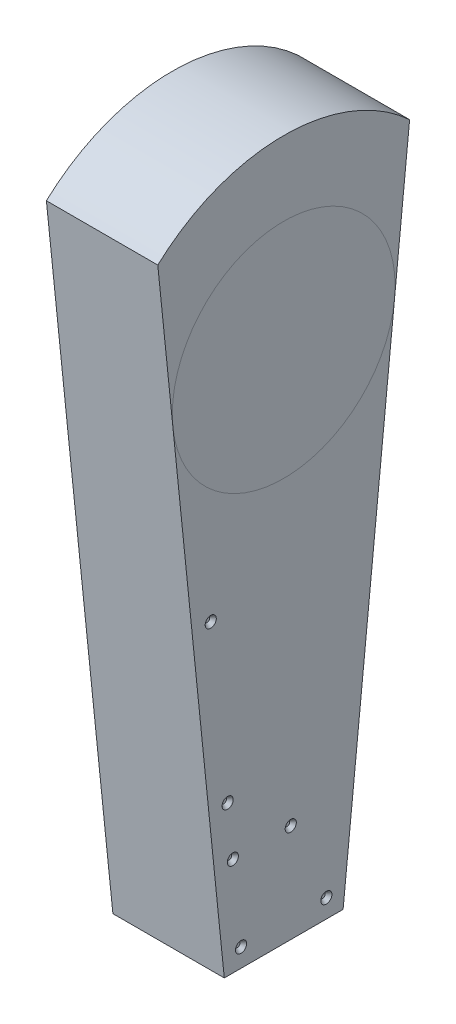
from build123d import *

# Parameters (mm, degrees)
SALIENTE_EXTRUIR1_DEPTH         = 76.2
CROQUIS4_R                      = 3.81
CORTAR_EXTRUIR1_DEPTH           = 2.54
CORTAR_EXTRUIR1_DRAFT           = -39
CORTAR_EXTRUIR1_PROFILE_2_DEPTH = 2.54
CORTAR_EXTRUIR1_PROFILE_2_DRAFT = -39
CORTAR_EXTRUIR1_PROFILE_3_DEPTH = 2.54
CORTAR_EXTRUIR1_PROFILE_3_DRAFT = -39
CORTAR_EXTRUIR1_PROFILE_4_DEPTH = 2.54
CORTAR_EXTRUIR1_PROFILE_4_DRAFT = -39
CORTAR_EXTRUIR1_PROFILE_5_DEPTH = 2.54
CORTAR_EXTRUIR1_PROFILE_5_DRAFT = -39
CORTAR_EXTRUIR1_PROFILE_6_DEPTH = 2.54
CORTAR_EXTRUIR1_PROFILE_6_DRAFT = -39
CROQUIS5_R                      = 3.81
CORTAR_EXTRUIR2_DEPTH           = 2.54
CORTAR_EXTRUIR2_DRAFT           = -39
CORTAR_EXTRUIR2_PROFILE_2_DEPTH = 2.54
CORTAR_EXTRUIR2_PROFILE_2_DRAFT = -39
CORTAR_EXTRUIR2_PROFILE_3_DEPTH = 2.54
CORTAR_EXTRUIR2_PROFILE_3_DRAFT = -39
CORTAR_EXTRUIR2_PROFILE_4_DEPTH = 2.54
CORTAR_EXTRUIR2_PROFILE_4_DRAFT = -39
CORTAR_EXTRUIR2_PROFILE_5_DEPTH = 2.54
CORTAR_EXTRUIR2_PROFILE_5_DRAFT = -39
CORTAR_EXTRUIR2_PROFILE_6_DEPTH = 2.54
CORTAR_EXTRUIR2_PROFILE_6_DRAFT = -39
CORTAR_EXTRUIR2_PROFILE_7_DEPTH = 2.54
CORTAR_EXTRUIR2_PROFILE_7_DRAFT = -39
CORTAR_EXTRUIR2_PROFILE_8_DEPTH = 2.54
CORTAR_EXTRUIR2_PROFILE_8_DRAFT = -39
CORTAR_EXTRUIR2_PROFILE_9_DEPTH = 2.54
CORTAR_EXTRUIR2_PROFILE_9_DRAFT = -39


with BuildPart() as part:
    # Croquis1 → Saliente-Extruir1 (new body)
    with BuildSketch(Plane(origin=(0, 0, 0), x_dir=(0, 0, -1), z_dir=(1, 0, 0))):
        with BuildLine():
            Line((-40.64, -351.79000001), (-86.135923686, 93.325251946))
            ThreePointArc((-86.135923686, 93.325251946), (0, 127), (86.135923686, 93.325251946))
            Line((86.135923686, 93.325251946), (40.64, -351.79000001))
            Line((40.64, -351.79000001), (-40.64, -351.79000001))
        make_face()
    extrude(amount=SALIENTE_EXTRUIR1_DEPTH)


with BuildPart() as cortar_extruir1_tool:
    # Croquis4 → Cortar-Extruir1 (with draft: the straight prism first)
    with BuildSketch(Plane(origin=(76.2, 0, 0), x_dir=(0, 0, -1), z_dir=(1, 0, 0))):
        with Locations((-49.917099877, -136.126844727)):
            Circle(CROQUIS4_R)
    extrude(amount=-CORTAR_EXTRUIR1_DEPTH)
    # Cortar-Extruir1: the draft: its side faces are tilted about the plane it starts from
    cortar_extruir1_sides = [cortar_extruir1_tool.faces().sort_by_distance(p)[0] for p in [
        (74.93, -136.126844727, 53.727099877),
    ]]
    draft(cortar_extruir1_sides, Plane(origin=(76.2, 0, 0), x_dir=(0, 0, -1), z_dir=(1, 0, 0)), CORTAR_EXTRUIR1_DRAFT)


with BuildPart() as part_1:
    add(part.part)

    # Cortar-Extruir1: cut by cortar_extruir1_tool
    add(cortar_extruir1_tool.part, mode=Mode.SUBTRACT)


with BuildPart() as cortar_extruir1_profile_2_tool:
    # Croquis4 → Cortar-Extruir1 profile 2 (with draft: the straight prism first)
    with BuildSketch(Plane(origin=(76.2, 0, 0), x_dir=(0, 0, -1), z_dir=(1, 0, 0))):
        with Locations((-38.362373799, -249.174001321)):
            Circle(CROQUIS4_R)
    extrude(amount=-CORTAR_EXTRUIR1_PROFILE_2_DEPTH)
    # Cortar-Extruir1 profile 2: the draft: its side faces are tilted about the plane it starts from
    cortar_extruir1_profile_2_sides = [cortar_extruir1_profile_2_tool.faces().sort_by_distance(p)[0] for p in [
        (74.93, -249.174001321, 42.172373799),
    ]]
    draft(cortar_extruir1_profile_2_sides, Plane(origin=(76.2, 0, 0), x_dir=(0, 0, -1), z_dir=(1, 0, 0)), CORTAR_EXTRUIR1_PROFILE_2_DRAFT)


with BuildPart() as part_2:
    add(part_1.part)

    # Cortar-Extruir1 profile 2: cut by cortar_extruir1_profile_2_tool
    add(cortar_extruir1_profile_2_tool.part, mode=Mode.SUBTRACT)


with BuildPart() as cortar_extruir1_profile_3_tool:
    # Croquis4 → Cortar-Extruir1 profile 3 (with draft: the straight prism first)
    with BuildSketch(Plane(origin=(76.2, 0, 0), x_dir=(0, 0, -1), z_dir=(1, 0, 0))):
        with Locations((-34.768096531, -284.339077712)):
            Circle(CROQUIS4_R)
    extrude(amount=-CORTAR_EXTRUIR1_PROFILE_3_DEPTH)
    # Cortar-Extruir1 profile 3: the draft: its side faces are tilted about the plane it starts from
    cortar_extruir1_profile_3_sides = [cortar_extruir1_profile_3_tool.faces().sort_by_distance(p)[0] for p in [
        (74.93, -284.339077712, 38.578096531),
    ]]
    draft(cortar_extruir1_profile_3_sides, Plane(origin=(76.2, 0, 0), x_dir=(0, 0, -1), z_dir=(1, 0, 0)), CORTAR_EXTRUIR1_PROFILE_3_DRAFT)


with BuildPart() as part_3:
    add(part_2.part)

    # Cortar-Extruir1 profile 3: cut by cortar_extruir1_profile_3_tool
    add(cortar_extruir1_profile_3_tool.part, mode=Mode.SUBTRACT)


with BuildPart() as cortar_extruir1_profile_4_tool:
    # Croquis4 → Cortar-Extruir1 profile 4 (with draft: the straight prism first)
    with BuildSketch(Plane(origin=(76.2, 0, 0), x_dir=(0, 0, -1), z_dir=(1, 0, 0))):
        with Locations((-29.171919425, -339.09000001)):
            Circle(CROQUIS4_R)
    extrude(amount=-CORTAR_EXTRUIR1_PROFILE_4_DEPTH)
    # Cortar-Extruir1 profile 4: the draft: its side faces are tilted about the plane it starts from
    cortar_extruir1_profile_4_sides = [cortar_extruir1_profile_4_tool.faces().sort_by_distance(p)[0] for p in [
        (74.93, -339.09000001, 32.981919425),
    ]]
    draft(cortar_extruir1_profile_4_sides, Plane(origin=(76.2, 0, 0), x_dir=(0, 0, -1), z_dir=(1, 0, 0)), CORTAR_EXTRUIR1_PROFILE_4_DRAFT)


with BuildPart() as part_4:
    add(part_3.part)

    # Cortar-Extruir1 profile 4: cut by cortar_extruir1_profile_4_tool
    add(cortar_extruir1_profile_4_tool.part, mode=Mode.SUBTRACT)


with BuildPart() as cortar_extruir1_profile_5_tool:
    # Croquis4 → Cortar-Extruir1 profile 5 (with draft: the straight prism first)
    with BuildSketch(Plane(origin=(76.2, 0, 0), x_dir=(0, 0, -1), z_dir=(1, 0, 0))):
        with Locations((29.171919425, -339.09000001)):
            Circle(CROQUIS4_R)
    extrude(amount=-CORTAR_EXTRUIR1_PROFILE_5_DEPTH)
    # Cortar-Extruir1 profile 5: the draft: its side faces are tilted about the plane it starts from
    cortar_extruir1_profile_5_sides = [cortar_extruir1_profile_5_tool.faces().sort_by_distance(p)[0] for p in [
        (74.93, -339.09000001, -25.361919425),
    ]]
    draft(cortar_extruir1_profile_5_sides, Plane(origin=(76.2, 0, 0), x_dir=(0, 0, -1), z_dir=(1, 0, 0)), CORTAR_EXTRUIR1_PROFILE_5_DRAFT)


with BuildPart() as part_5:
    add(part_4.part)

    # Cortar-Extruir1 profile 5: cut by cortar_extruir1_profile_5_tool
    add(cortar_extruir1_profile_5_tool.part, mode=Mode.SUBTRACT)


with BuildPart() as cortar_extruir1_profile_6_tool:
    # Croquis4 → Cortar-Extruir1 profile 6 (with draft: the straight prism first)
    with BuildSketch(Plane(origin=(76.2, 0, 0), x_dir=(0, 0, -1), z_dir=(1, 0, 0))):
        with Locations((4.819460737, -284.339077712)):
            Circle(CROQUIS4_R)
    extrude(amount=-CORTAR_EXTRUIR1_PROFILE_6_DEPTH)
    # Cortar-Extruir1 profile 6: the draft: its side faces are tilted about the plane it starts from
    cortar_extruir1_profile_6_sides = [cortar_extruir1_profile_6_tool.faces().sort_by_distance(p)[0] for p in [
        (74.93, -284.339077712, -1.009460737),
    ]]
    draft(cortar_extruir1_profile_6_sides, Plane(origin=(76.2, 0, 0), x_dir=(0, 0, -1), z_dir=(1, 0, 0)), CORTAR_EXTRUIR1_PROFILE_6_DRAFT)


with BuildPart() as part_6:
    add(part_5.part)

    # Cortar-Extruir1 profile 6: cut by cortar_extruir1_profile_6_tool
    add(cortar_extruir1_profile_6_tool.part, mode=Mode.SUBTRACT)


with BuildPart() as cortar_extruir2_tool:
    # Croquis5 → Cortar-Extruir2 (with draft: the straight prism first)
    with BuildSketch(Plane.ZY):
        with Locations((-12.556850651, -339.09000001)):
            Circle(CROQUIS5_R)
    extrude(amount=-CORTAR_EXTRUIR2_DEPTH)
    # Cortar-Extruir2: the draft: its side faces are tilted about the plane it starts from
    cortar_extruir2_sides = [cortar_extruir2_tool.faces().sort_by_distance(p)[0] for p in [
        (1.27, -339.09000001, -16.366850651),
    ]]
    draft(cortar_extruir2_sides, Plane.ZY, CORTAR_EXTRUIR2_DRAFT)


with BuildPart() as part_7:
    add(part_6.part)

    # Cortar-Extruir2: cut by cortar_extruir2_tool
    add(cortar_extruir2_tool.part, mode=Mode.SUBTRACT)


with BuildPart() as cortar_extruir2_profile_2_tool:
    # Croquis5 → Cortar-Extruir2 profile 2 (with draft: the straight prism first)
    with BuildSketch(Plane.ZY):
        with Locations((12.556850651, -339.09000001)):
            Circle(CROQUIS5_R)
    extrude(amount=-CORTAR_EXTRUIR2_PROFILE_2_DEPTH)
    # Cortar-Extruir2 profile 2: the draft: its side faces are tilted about the plane it starts from
    cortar_extruir2_profile_2_sides = [cortar_extruir2_profile_2_tool.faces().sort_by_distance(p)[0] for p in [
        (1.27, -339.09000001, 8.746850651),
    ]]
    draft(cortar_extruir2_profile_2_sides, Plane.ZY, CORTAR_EXTRUIR2_PROFILE_2_DRAFT)


with BuildPart() as part_8:
    add(part_7.part)

    # Cortar-Extruir2 profile 2: cut by cortar_extruir2_profile_2_tool
    add(cortar_extruir2_profile_2_tool.part, mode=Mode.SUBTRACT)


with BuildPart() as cortar_extruir2_profile_3_tool:
    # Croquis5 → Cortar-Extruir2 profile 3 (with draft: the straight prism first)
    with BuildSketch(Plane.ZY):
        with Locations((-34.182100121, -290.072249352)):
            Circle(CROQUIS5_R)
    extrude(amount=-CORTAR_EXTRUIR2_PROFILE_3_DEPTH)
    # Cortar-Extruir2 profile 3: the draft: its side faces are tilted about the plane it starts from
    cortar_extruir2_profile_3_sides = [cortar_extruir2_profile_3_tool.faces().sort_by_distance(p)[0] for p in [
        (1.27, -290.072249352, -37.992100121),
    ]]
    draft(cortar_extruir2_profile_3_sides, Plane.ZY, CORTAR_EXTRUIR2_PROFILE_3_DRAFT)


with BuildPart() as part_9:
    add(part_8.part)

    # Cortar-Extruir2 profile 3: cut by cortar_extruir2_profile_3_tool
    add(cortar_extruir2_profile_3_tool.part, mode=Mode.SUBTRACT)


with BuildPart() as cortar_extruir2_profile_4_tool:
    # Croquis5 → Cortar-Extruir2 profile 4 (with draft: the straight prism first)
    with BuildSketch(Plane.ZY):
        with Locations((-48.265473167, -152.285748198)):
            Circle(CROQUIS5_R)
    extrude(amount=-CORTAR_EXTRUIR2_PROFILE_4_DEPTH)
    # Cortar-Extruir2 profile 4: the draft: its side faces are tilted about the plane it starts from
    cortar_extruir2_profile_4_sides = [cortar_extruir2_profile_4_tool.faces().sort_by_distance(p)[0] for p in [
        (1.27, -152.285748198, -52.075473167),
    ]]
    draft(cortar_extruir2_profile_4_sides, Plane.ZY, CORTAR_EXTRUIR2_PROFILE_4_DRAFT)


with BuildPart() as part_10:
    add(part_9.part)

    # Cortar-Extruir2 profile 4: cut by cortar_extruir2_profile_4_tool
    add(cortar_extruir2_profile_4_tool.part, mode=Mode.SUBTRACT)


with BuildPart() as cortar_extruir2_profile_5_tool:
    # Croquis5 → Cortar-Extruir2 profile 5 (with draft: the straight prism first)
    with BuildSketch(Plane.ZY):
        with Locations((-69.751939629, 57.929874619)):
            Circle(CROQUIS5_R)
    extrude(amount=-CORTAR_EXTRUIR2_PROFILE_5_DEPTH)
    # Cortar-Extruir2 profile 5: the draft: its side faces are tilted about the plane it starts from
    cortar_extruir2_profile_5_sides = [cortar_extruir2_profile_5_tool.faces().sort_by_distance(p)[0] for p in [
        (1.27, 57.929874619, -73.561939629),
    ]]
    draft(cortar_extruir2_profile_5_sides, Plane.ZY, CORTAR_EXTRUIR2_PROFILE_5_DRAFT)


with BuildPart() as part_11:
    add(part_10.part)

    # Cortar-Extruir2 profile 5: cut by cortar_extruir2_profile_5_tool
    add(cortar_extruir2_profile_5_tool.part, mode=Mode.SUBTRACT)


with BuildPart() as cortar_extruir2_profile_6_tool:
    # Croquis5 → Cortar-Extruir2 profile 6 (with draft: the straight prism first)
    with BuildSketch(Plane.ZY):
        with Locations((-48.265473167, 103.609527072)):
            Circle(CROQUIS5_R)
    extrude(amount=-CORTAR_EXTRUIR2_PROFILE_6_DEPTH)
    # Cortar-Extruir2 profile 6: the draft: its side faces are tilted about the plane it starts from
    cortar_extruir2_profile_6_sides = [cortar_extruir2_profile_6_tool.faces().sort_by_distance(p)[0] for p in [
        (1.27, 103.609527072, -52.075473167),
    ]]
    draft(cortar_extruir2_profile_6_sides, Plane.ZY, CORTAR_EXTRUIR2_PROFILE_6_DRAFT)


with BuildPart() as part_12:
    add(part_11.part)

    # Cortar-Extruir2 profile 6: cut by cortar_extruir2_profile_6_tool
    add(cortar_extruir2_profile_6_tool.part, mode=Mode.SUBTRACT)


with BuildPart() as cortar_extruir2_profile_7_tool:
    # Croquis5 → Cortar-Extruir2 profile 7 (with draft: the straight prism first)
    with BuildSketch(Plane.ZY):
        with Locations((48.265473167, 103.609527072)):
            Circle(CROQUIS5_R)
    extrude(amount=-CORTAR_EXTRUIR2_PROFILE_7_DEPTH)
    # Cortar-Extruir2 profile 7: the draft: its side faces are tilted about the plane it starts from
    cortar_extruir2_profile_7_sides = [cortar_extruir2_profile_7_tool.faces().sort_by_distance(p)[0] for p in [
        (1.27, 103.609527072, 44.455473167),
    ]]
    draft(cortar_extruir2_profile_7_sides, Plane.ZY, CORTAR_EXTRUIR2_PROFILE_7_DRAFT)


with BuildPart() as part_13:
    add(part_12.part)

    # Cortar-Extruir2 profile 7: cut by cortar_extruir2_profile_7_tool
    add(cortar_extruir2_profile_7_tool.part, mode=Mode.SUBTRACT)


with BuildPart() as cortar_extruir2_profile_8_tool:
    # Croquis5 → Cortar-Extruir2 profile 8 (with draft: the straight prism first)
    with BuildSketch(Plane.ZY):
        with Locations((69.751939629, 57.929874619)):
            Circle(CROQUIS5_R)
    extrude(amount=-CORTAR_EXTRUIR2_PROFILE_8_DEPTH)
    # Cortar-Extruir2 profile 8: the draft: its side faces are tilted about the plane it starts from
    cortar_extruir2_profile_8_sides = [cortar_extruir2_profile_8_tool.faces().sort_by_distance(p)[0] for p in [
        (1.27, 57.929874619, 65.941939629),
    ]]
    draft(cortar_extruir2_profile_8_sides, Plane.ZY, CORTAR_EXTRUIR2_PROFILE_8_DRAFT)


with BuildPart() as part_14:
    add(part_13.part)

    # Cortar-Extruir2 profile 8: cut by cortar_extruir2_profile_8_tool
    add(cortar_extruir2_profile_8_tool.part, mode=Mode.SUBTRACT)


with BuildPart() as cortar_extruir2_profile_9_tool:
    # Croquis5 → Cortar-Extruir2 profile 9 (with draft: the straight prism first)
    with BuildSketch(Plane.ZY):
        with Locations((48.265473167, -152.285748198)):
            Circle(CROQUIS5_R)
    extrude(amount=-CORTAR_EXTRUIR2_PROFILE_9_DEPTH)
    # Cortar-Extruir2 profile 9: the draft: its side faces are tilted about the plane it starts from
    cortar_extruir2_profile_9_sides = [cortar_extruir2_profile_9_tool.faces().sort_by_distance(p)[0] for p in [
        (1.27, -152.285748198, 44.455473167),
    ]]
    draft(cortar_extruir2_profile_9_sides, Plane.ZY, CORTAR_EXTRUIR2_PROFILE_9_DRAFT)


with BuildPart() as part_15:
    add(part_14.part)

    # Cortar-Extruir2 profile 9: cut by cortar_extruir2_profile_9_tool
    add(cortar_extruir2_profile_9_tool.part, mode=Mode.SUBTRACT)


solid = part_15.part
